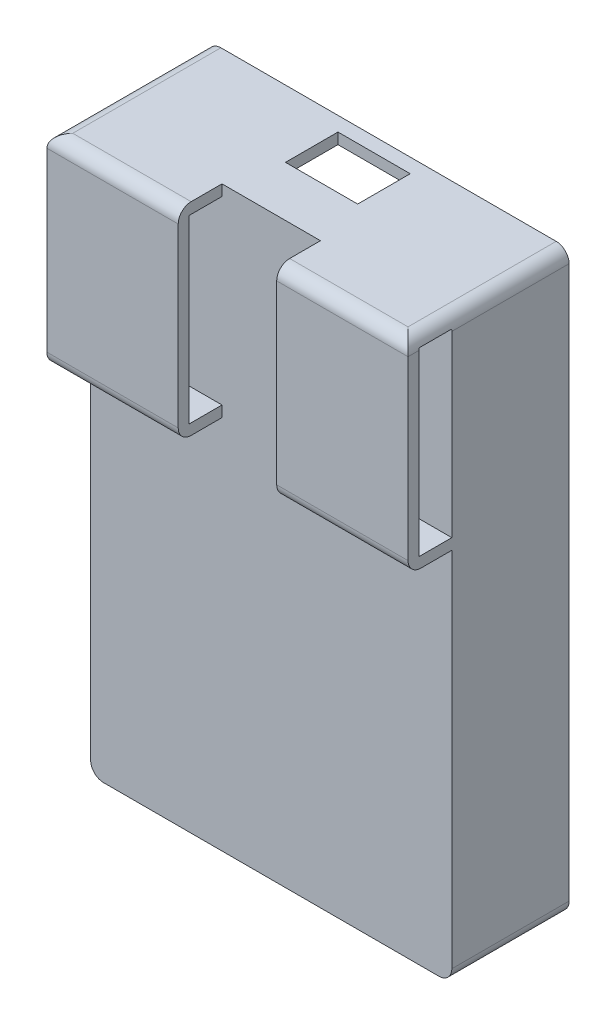
from build123d import *

# Parameters (mm, degrees)
SKETCH1_W           = 83.82
SKETCH1_H           = 27.225
BOSS_EXTRUDE1_DEPTH = 87.122
SHELL1_T            = -2.54
SKETCH12_W          = 83.82
SKETCH12_H          = 27.225
BOSS_EXTRUDE6_DEPTH = 46.99
SHELL2_START        = 2.54
SHELL2_OUTLINE_W    = 44.45
SHELL2_OUTLINE_H    = 24.685
SHELL2_DEPTH        = 78.74
SKETCH5_R           = 3.175
SKETCH5_R_2         = 1.5
BOSS_EXTRUDE7_DEPTH = 1.905
CUT_EXTRUDE10_REACH = 162.477
SKETCH14_W          = 16.764
SKETCH14_H          = 12.192
SKETCH15_W          = 30.48
SKETCH15_H          = 46.99
BOSS_EXTRUDE8_DEPTH = 10.16
SKETCH16_W          = 7.62
SKETCH16_H          = 41.91
CUT_EXTRUDE11_DEPTH = 161.477479943
CHAMFER1_SIZE       = 5.08
SKETCH17_R          = 1.5
CUT_EXTRUDE12_DEPTH = 10
FILLET1_R           = 3


# Read off the part's stored shape, not the designer's step: Shell2
with BuildPart() as part:
    # Sketch1 → Boss-Extrude1 (new body)
    with BuildSketch(Plane(origin=(0, 0, 0), x_dir=(1, 0, 0), z_dir=(0, 1, 0))):
        with Locations((41.91, 13.6125)):
            Rectangle(SKETCH1_W, SKETCH1_H)
    extrude(amount=BOSS_EXTRUDE1_DEPTH)

    # Shell1
    shell1_openings = [part.faces().sort_by_distance(p)[0] for p in [
        (41.91, 43.561, -27.225),
    ]]
    offset(amount=SHELL1_T, openings=shell1_openings, kind=Kind.INTERSECTION)

    # Sketch12 → Boss-Extrude6 (add)
    with BuildSketch(Plane(origin=(0, 87.122, 0), x_dir=(1, 0, 0), z_dir=(0, 1, 0))):
        with Locations((41.91, 13.6125)):
            Rectangle(SKETCH12_W, SKETCH12_H)
    extrude(amount=BOSS_EXTRUDE6_DEPTH)

    # Shell2 outline → Shell2 (cut)
    with BuildSketch(Plane.YZ.offset(SHELL2_START)):
        with Locations((109.347, -14.8825)):
            Rectangle(SHELL2_OUTLINE_W, SHELL2_OUTLINE_H)
    extrude(amount=SHELL2_DEPTH, mode=Mode.SUBTRACT)

    # Sketch5 → Boss-Extrude7 (add)
    # profile 1 of 4: a face of its own
    with BuildSketch(Plane(origin=(0, 88.392, -2.54), x_dir=(1, 0, 0), z_dir=(0, 0, -1))):
        with Locations((15.24, -29.845)):
            Circle(SKETCH5_R)
        with Locations((15.24, -29.845)):
            Circle(SKETCH5_R_2, mode=Mode.SUBTRACT)
    # profile 2 of 4: a face of its own
    with BuildSketch(Plane(origin=(0, 88.392, -2.54), x_dir=(1, 0, 0), z_dir=(0, 0, -1))):
        with Locations((15.24, -9.525)):
            Circle(SKETCH5_R)
        with Locations((15.24, -9.525)):
            Circle(SKETCH5_R_2, mode=Mode.SUBTRACT)
    # profile 3 of 4: a face of its own
    with BuildSketch(Plane(origin=(0, 88.392, -2.54), x_dir=(1, 0, 0), z_dir=(0, 0, -1))):
        with Locations((49.53, -9.525)):
            Circle(SKETCH5_R)
        with Locations((49.53, -9.525)):
            Circle(SKETCH5_R_2, mode=Mode.SUBTRACT)
    # profile 4 of 4: a face of its own
    with BuildSketch(Plane(origin=(0, 88.392, -2.54), x_dir=(1, 0, 0), z_dir=(0, 0, -1))):
        with Locations((49.53, -29.845)):
            Circle(SKETCH5_R)
        with Locations((49.53, -29.845)):
            Circle(SKETCH5_R_2, mode=Mode.SUBTRACT)
    extrude(amount=BOSS_EXTRUDE7_DEPTH)

    # Sketch14 → Cut-Extrude10 (cut, up to next)
    with BuildSketch(Plane(origin=(0, 134.112, 0), x_dir=(1, 0, 0), z_dir=(0, 1, 0)), mode=Mode.PRIVATE) as cut_extrude10_sk1:
        with Locations((41.91, 17.78)):
            Rectangle(SKETCH14_W, SKETCH14_H)
    cut_extrude10_tool1 = extrude(cut_extrude10_sk1.sketch, amount=-CUT_EXTRUDE10_REACH, mode=Mode.PRIVATE) & part.part
    add(cut_extrude10_tool1.solids().sort_by_distance((41.91, 134.112, -17.78))[0], mode=Mode.SUBTRACT)

    # Sketch15 → Boss-Extrude8 (add)
    with BuildSketch(Plane.XY):
        with Locations((15.24, 110.617)):
            Rectangle(SKETCH15_W, SKETCH15_H)
        with Locations((68.58, 110.617)):
            Rectangle(SKETCH15_W, SKETCH15_H)
    extrude(amount=BOSS_EXTRUDE8_DEPTH)

    # Sketch16 → Cut-Extrude11 (cut, through all)
    with BuildSketch(Plane.ZY):
        with Locations((3.81, 110.617)):
            Rectangle(SKETCH16_W, SKETCH16_H)
    extrude(amount=-CUT_EXTRUDE11_DEPTH, mode=Mode.SUBTRACT)

    # Chamfer1
    chamfer1_edges = [part.edges().sort_by_distance(p)[0] for p in [
        (2.54, 2.54, -14.8825),
        (81.28, 2.54, -14.8825),
        (2.54, 84.582, -14.8825),
        (81.28, 84.582, -14.8825),
    ]]
    chamfer(chamfer1_edges, length=CHAMFER1_SIZE)

    # Sketch17 → Cut-Extrude12 (cut)
    with BuildSketch(Plane(origin=(0, 0, -27.225), x_dir=(-1, 0, 0), z_dir=(0, 0, -1))):
        with Locations((-3, 84.122)):
            Circle(SKETCH17_R)
        with Locations((-80.82, 84.122)):
            Circle(SKETCH17_R)
        with Locations((-80.82, 3)):
            Circle(SKETCH17_R)
        with Locations((-3, 3)):
            Circle(SKETCH17_R)
    extrude(amount=-CUT_EXTRUDE12_DEPTH, mode=Mode.SUBTRACT)

    # Fillet1
    # the kernel refuses this fillet: 3 mm, written as the material it takes off along each edge
    with BuildSketch(Plane(origin=(91.32, 134.112, 10.16), x_dir=(0, 0, -1), z_dir=(-1, 0, 0)), Plane(origin=(45.84, 87.122, 10.16), x_dir=(0, 0, -1), z_dir=(1, 0, 0)), Plane(origin=(37.98, 87.122, 10.16), x_dir=(0, 1, 0), z_dir=(-1, 0, 0))) as fillet1_piece_1:
        with BuildLine():
            CenterArc((FILLET1_R, FILLET1_R), FILLET1_R, 180, 90)
            Line((0, FILLET1_R), (0, 0))
            Line((0, 0), (FILLET1_R, 0))
        make_face()
    extrude(amount=45.48, mode=Mode.SUBTRACT)
    with BuildSketch(Plane(origin=(-7.5, 134.112, 10.16), x_dir=(0, 0, -1), z_dir=(1, 0, 0))) as fillet1_piece_2:
        with BuildLine():
            CenterArc((FILLET1_R, -FILLET1_R), FILLET1_R, 90, 90)
            Line((0, -FILLET1_R), (0, 0))
            Line((0, 0), (FILLET1_R, 0))
        make_face()
    extrude(amount=45.48, mode=Mode.SUBTRACT)
    with BuildSketch(Plane(origin=(83.82, 134.112, -34.725), x_dir=(0, -1, 0), z_dir=(0, 0, 1))) as fillet1_piece_3:
        with BuildLine():
            CenterArc((FILLET1_R, -FILLET1_R), FILLET1_R, 90, 90)
            Line((0, -FILLET1_R), (0, 0))
            Line((0, 0), (FILLET1_R, 0))
        make_face()
    extrude(amount=52.385, mode=Mode.SUBTRACT)
    with BuildSketch(Plane(origin=(83.82, 0, 7.5), x_dir=(0, 1, 0), z_dir=(0, 0, -1))) as fillet1_piece_4:
        with BuildLine():
            CenterArc((FILLET1_R, -FILLET1_R), FILLET1_R, 90, 90)
            Line((0, -FILLET1_R), (0, 0))
            Line((0, 0), (FILLET1_R, 0))
        make_face()
    extrude(amount=42.225, mode=Mode.SUBTRACT)
    with BuildSketch(Plane(origin=(0, 0, -34.725), x_dir=(1, 0, 0), z_dir=(0, 0, 1))) as fillet1_piece_5:
        with BuildLine():
            CenterArc((FILLET1_R, FILLET1_R), FILLET1_R, 180, 90)
            Line((0, FILLET1_R), (0, 0))
            Line((0, 0), (FILLET1_R, 0))
        make_face()
    extrude(amount=42.225, mode=Mode.SUBTRACT)
    with BuildSketch(Plane(origin=(0, 134.112, 17.66), x_dir=(1, 0, 0), z_dir=(0, 0, -1))) as fillet1_piece_6:
        with BuildLine():
            CenterArc((FILLET1_R, FILLET1_R), FILLET1_R, 180, 90)
            Line((0, FILLET1_R), (0, 0))
            Line((0, 0), (FILLET1_R, 0))
        make_face()
    extrude(amount=52.385, mode=Mode.SUBTRACT)


solid = part.part
